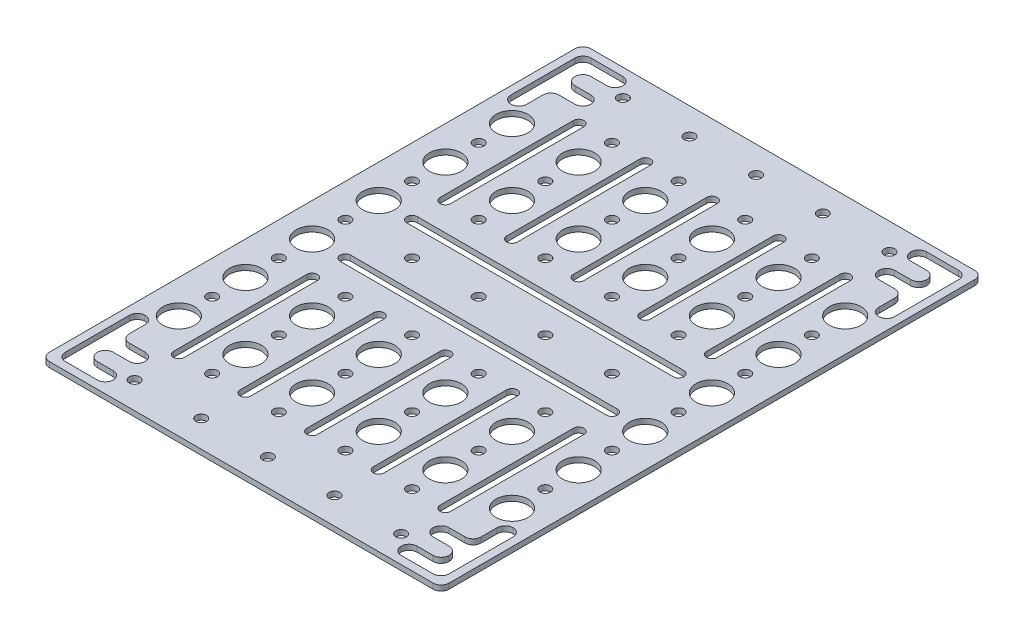
from build123d import *

# Parameters (mm, degrees)
SKETCH_1_W          = 150
SKETCH_1_H          = 203.2
EXTRUDE_1_DEPTH     = 2
SKETCH_2_R          = 2
SKETCH_2_R_2        = 6
CUT_EXTRUDE_1_DEPTH = 127.299485351
CUT_EXTRUDE_2_DEPTH = 127.299485351
FILLET_1_R          = 3


with BuildPart() as part:
    # 草图1 → 凸台-拉伸1 (new body)
    with BuildSketch(Plane(origin=(0, 0, 0), x_dir=(1, 0, 0), z_dir=(0, 1, 0))):
        Rectangle(SKETCH_1_W, SKETCH_1_H)
    extrude(amount=EXTRUDE_1_DEPTH)

    # 草图2 → 切除-拉伸1 (cut, through all)
    with BuildSketch(Plane(origin=(0, 2, 0), x_dir=(1, 0, 0), z_dir=(0, 1, 0))):
        with Locations(Location((-50, 91.6, 0), (0, 0, 270))):
            Circle(SKETCH_2_R)
        with Locations(Location((-25, 91.6, 0), (0, 0, 270))):
            Circle(SKETCH_2_R)
        with Locations(Location((0, 91.6, 0), (0, 0, 270))):
            Circle(SKETCH_2_R)
        with Locations(Location((25, 91.6, 0), (0, 0, 270))):
            Circle(SKETCH_2_R)
        with Locations(Location((50, 91.6, 0), (0, 0, 270))):
            Circle(SKETCH_2_R)
        with Locations(Location((50, -91.6, 0), (0, 0, 90))):
            Circle(SKETCH_2_R)
        with Locations(Location((25, -91.6, 0), (0, 0, 90))):
            Circle(SKETCH_2_R)
        with Locations(Location((0, -91.6, 0), (0, 0, 90))):
            Circle(SKETCH_2_R)
        with Locations(Location((-25, -91.6, 0), (0, 0, 90))):
            Circle(SKETCH_2_R)
        with Locations(Location((-50, -91.6, 0), (0, 0, 90))):
            Circle(SKETCH_2_R)
        with Locations(Location((-62.5, 0, 0), (0, 0, 270))):
            Circle(SKETCH_2_R)
        with Locations(Location((-37.5, 0, 0), (0, 0, 270))):
            Circle(SKETCH_2_R)
        with Locations(Location((-12.5, 0, 0), (0, 0, 270))):
            Circle(SKETCH_2_R)
        with Locations(Location((12.5, 0, 0), (0, 0, 270))):
            Circle(SKETCH_2_R)
        with Locations(Location((37.5, 0, 0), (0, 0, 270))):
            Circle(SKETCH_2_R)
        with Locations(Location((62.5, 0, 0), (0, 0, 270))):
            Circle(SKETCH_2_R)
        with Locations(Location((-37.5, 25, 0), (0, 0, 270))):
            Circle(SKETCH_2_R)
        with Locations(Location((-12.5, 25, 0), (0, 0, 270))):
            Circle(SKETCH_2_R)
        with Locations(Location((12.5, 25, 0), (0, 0, 270))):
            Circle(SKETCH_2_R)
        with Locations(Location((37.5, 25, 0), (0, 0, 270))):
            Circle(SKETCH_2_R)
        with Locations(Location((62.5, 25, 0), (0, 0, 270))):
            Circle(SKETCH_2_R)
        with Locations(Location((-37.5, 50, 0), (0, 0, 270))):
            Circle(SKETCH_2_R)
        with Locations(Location((-12.5, 50, 0), (0, 0, 270))):
            Circle(SKETCH_2_R)
        with Locations(Location((12.5, 50, 0), (0, 0, 270))):
            Circle(SKETCH_2_R)
        with Locations(Location((37.5, 50, 0), (0, 0, 270))):
            Circle(SKETCH_2_R)
        with Locations(Location((62.5, 50, 0), (0, 0, 270))):
            Circle(SKETCH_2_R)
        with Locations(Location((-37.5, 75, 0), (0, 0, 270))):
            Circle(SKETCH_2_R)
        with Locations(Location((-12.5, 75, 0), (0, 0, 270))):
            Circle(SKETCH_2_R)
        with Locations(Location((12.5, 75, 0), (0, 0, 270))):
            Circle(SKETCH_2_R)
        with Locations(Location((37.5, 75, 0), (0, 0, 270))):
            Circle(SKETCH_2_R)
        with Locations(Location((-62.5, 25, 0), (0, 0, 270))):
            Circle(SKETCH_2_R)
        with Locations(Location((-62.5, 50, 0), (0, 0, 270))):
            Circle(SKETCH_2_R)
        with Locations(Location((62.5, -25, 0), (0, 0, 90))):
            Circle(SKETCH_2_R)
        with Locations(Location((37.5, -25, 0), (0, 0, 90))):
            Circle(SKETCH_2_R)
        with Locations(Location((12.5, -25, 0), (0, 0, 90))):
            Circle(SKETCH_2_R)
        with Locations(Location((-12.5, -25, 0), (0, 0, 90))):
            Circle(SKETCH_2_R)
        with Locations(Location((-37.5, -25, 0), (0, 0, 90))):
            Circle(SKETCH_2_R)
        with Locations(Location((-62.5, -25, 0), (0, 0, 90))):
            Circle(SKETCH_2_R)
        with Locations(Location((-62.5, -50, 0), (0, 0, 90))):
            Circle(SKETCH_2_R)
        with Locations(Location((-37.5, -50, 0), (0, 0, 90))):
            Circle(SKETCH_2_R)
        with Locations(Location((-12.5, -50, 0), (0, 0, 90))):
            Circle(SKETCH_2_R)
        with Locations(Location((12.5, -50, 0), (0, 0, 90))):
            Circle(SKETCH_2_R)
        with Locations(Location((37.5, -50, 0), (0, 0, 90))):
            Circle(SKETCH_2_R)
        with Locations(Location((62.5, -50, 0), (0, 0, 90))):
            Circle(SKETCH_2_R)
        with Locations(Location((37.5, -75, 0), (0, 0, 90))):
            Circle(SKETCH_2_R)
        with Locations(Location((12.5, -75, 0), (0, 0, 90))):
            Circle(SKETCH_2_R)
        with Locations(Location((-12.5, -75, 0), (0, 0, 90))):
            Circle(SKETCH_2_R)
        with Locations(Location((-37.5, -75, 0), (0, 0, 90))):
            Circle(SKETCH_2_R)
        with Locations(Location((-62.5, 62.5, 0), (0, 0, 270))):
            Circle(SKETCH_2_R_2)
        with Locations(Location((-37.5, 62.5, 0), (0, 0, 270))):
            Circle(SKETCH_2_R_2)
        with Locations(Location((-12.5, 62.5, 0), (0, 0, 270))):
            Circle(SKETCH_2_R_2)
        with Locations(Location((12.5, 62.5, 0), (0, 0, 270))):
            Circle(SKETCH_2_R_2)
        with Locations(Location((37.5, 62.5, 0), (0, 0, 270))):
            Circle(SKETCH_2_R_2)
        with Locations(Location((62.5, 62.5, 0), (0, 0, 270))):
            Circle(SKETCH_2_R_2)
        with Locations(Location((-37.5, 37.5, 0), (0, 0, 270))):
            Circle(SKETCH_2_R_2)
        with Locations(Location((-12.5, 37.5, 0), (0, 0, 270))):
            Circle(SKETCH_2_R_2)
        with Locations(Location((12.5, 37.5, 0), (0, 0, 270))):
            Circle(SKETCH_2_R_2)
        with Locations(Location((37.5, 37.5, 0), (0, 0, 270))):
            Circle(SKETCH_2_R_2)
        with Locations(Location((62.5, 37.5, 0), (0, 0, 270))):
            Circle(SKETCH_2_R_2)
        with Locations(Location((62.5, 12.5, 0), (0, 0, 270))):
            Circle(SKETCH_2_R_2)
        with Locations(Location((62.5, -12.5, 0), (0, 0, 270))):
            Circle(SKETCH_2_R_2)
        with Locations(Location((-37.5, -37.5, 0), (0, 0, 270))):
            Circle(SKETCH_2_R_2)
        with Locations(Location((-12.5, -37.5, 0), (0, 0, 270))):
            Circle(SKETCH_2_R_2)
        with Locations(Location((12.5, -37.5, 0), (0, 0, 270))):
            Circle(SKETCH_2_R_2)
        with Locations(Location((37.5, -37.5, 0), (0, 0, 270))):
            Circle(SKETCH_2_R_2)
        with Locations(Location((62.5, -37.5, 0), (0, 0, 270))):
            Circle(SKETCH_2_R_2)
        with Locations(Location((-37.5, -62.5, 0), (0, 0, 270))):
            Circle(SKETCH_2_R_2)
        with Locations(Location((-12.5, -62.5, 0), (0, 0, 270))):
            Circle(SKETCH_2_R_2)
        with Locations(Location((12.5, -62.5, 0), (0, 0, 270))):
            Circle(SKETCH_2_R_2)
        with Locations(Location((37.5, -62.5, 0), (0, 0, 270))):
            Circle(SKETCH_2_R_2)
        with Locations(Location((62.5, -62.5, 0), (0, 0, 270))):
            Circle(SKETCH_2_R_2)
        with Locations(Location((-62.5, 37.5, 0), (0, 0, 270))):
            Circle(SKETCH_2_R_2)
        with Locations(Location((-62.5, 12.5, 0), (0, 0, 270))):
            Circle(SKETCH_2_R_2)
        with Locations(Location((-62.5, -12.5, 0), (0, 0, 270))):
            Circle(SKETCH_2_R_2)
        with Locations(Location((-62.5, -37.5, 0), (0, 0, 270))):
            Circle(SKETCH_2_R_2)
        with Locations(Location((-62.5, -62.5, 0), (0, 0, 270))):
            Circle(SKETCH_2_R_2)
        with BuildLine():
            Line((-48, 75), (-48, 25))
            ThreePointArc((-48, 25), (-50, 23), (-52, 25))
            Line((-52, 25), (-52, 75))
            ThreePointArc((-52, 75), (-50, 77), (-48, 75))
        make_face()
        with BuildLine():
            Line((-23, 75), (-23, 25))
            ThreePointArc((-23, 25), (-25, 23), (-27, 25))
            Line((-27, 25), (-27, 75))
            ThreePointArc((-27, 75), (-25, 77), (-23, 75))
        make_face()
        with BuildLine():
            Line((2, 75), (2, 25))
            ThreePointArc((2, 25), (0, 23), (-2, 25))
            Line((-2, 25), (-2, 75))
            ThreePointArc((-2, 75), (0, 77), (2, 75))
        make_face()
        with BuildLine():
            Line((27, 75), (27, 25))
            ThreePointArc((27, 25), (25, 23), (23, 25))
            Line((23, 25), (23, 75))
            ThreePointArc((23, 75), (25, 77), (27, 75))
        make_face()
        with BuildLine():
            Line((52, 75), (52, 25))
            ThreePointArc((52, 25), (50, 23), (48, 25))
            Line((48, 25), (48, 75))
            ThreePointArc((48, 75), (50, 77), (52, 75))
        make_face()
        with BuildLine():
            Line((-48, -75), (-48, -25))
            ThreePointArc((-48, -25), (-50, -23), (-52, -25))
            Line((-52, -25), (-52, -75))
            ThreePointArc((-52, -75), (-50, -77), (-48, -75))
        make_face()
        with BuildLine():
            Line((-23, -75), (-23, -25))
            ThreePointArc((-23, -25), (-25, -23), (-27, -25))
            Line((-27, -25), (-27, -75))
            ThreePointArc((-27, -75), (-25, -77), (-23, -75))
        make_face()
        with BuildLine():
            Line((2, -75), (2, -25))
            ThreePointArc((2, -25), (0, -23), (-2, -25))
            Line((-2, -25), (-2, -75))
            ThreePointArc((-2, -75), (0, -77), (2, -75))
        make_face()
        with BuildLine():
            Line((27, -75), (27, -25))
            ThreePointArc((27, -25), (25, -23), (23, -25))
            Line((23, -25), (23, -75))
            ThreePointArc((23, -75), (25, -77), (27, -75))
        make_face()
        with BuildLine():
            Line((52, -75), (52, -25))
            ThreePointArc((52, -25), (50, -23), (48, -25))
            Line((48, -25), (48, -75))
            ThreePointArc((48, -75), (50, -77), (52, -75))
        make_face()
        with BuildLine():
            Line((-50, 14.5), (50, 14.5))
            ThreePointArc((50, 14.5), (52, 12.5), (50, 10.5))
            Line((50, 10.5), (-50, 10.5))
            ThreePointArc((-50, 10.5), (-52, 12.5), (-50, 14.5))
        make_face()
        with BuildLine():
            Line((-50, -14.5), (50, -14.5))
            ThreePointArc((50, -14.5), (52, -12.5), (50, -10.5))
            Line((50, -10.5), (-50, -10.5))
            ThreePointArc((-50, -10.5), (-52, -12.5), (-50, -14.5))
        make_face()
    extrude(amount=-CUT_EXTRUDE_1_DEPTH, mode=Mode.SUBTRACT)

    # 草图3 → 切除-拉伸2 (cut, through all)
    with BuildSketch(Plane(origin=(0, 2, 0), x_dir=(1, 0, 0), z_dir=(0, 1, 0))):
        Polygon((-72, 98.6), (-54, 98.6), (-54, 92.6), (-66, 92.6), (-66, 86.6), (-54, 86.6), (-54, 80.6), (-66, 80.6), (-66, 68.6), (-72, 68.6), align=None)
        Polygon((66, 68.6), (72, 68.6), (72, 98.6), (54, 98.6), (54, 92.6), (66, 92.6), (66, 86.6), (54, 86.6), (54, 80.6), (66, 80.6), align=None)
        Polygon((-66, -68.6), (-72, -68.6), (-72, -98.6), (-54, -98.6), (-54, -92.6), (-66, -92.6), (-66, -86.6), (-54, -86.6), (-54, -80.6), (-66, -80.6), align=None)
        Polygon((66, -80.6), (66, -68.6), (72, -68.6), (72, -98.6), (54, -98.6), (54, -92.6), (66, -92.6), (66, -86.6), (54, -86.6), (54, -80.6), align=None)
    extrude(amount=-CUT_EXTRUDE_2_DEPTH, mode=Mode.SUBTRACT)

    # 圆角1
    fillet_1_edges = [part.edges().sort_by_distance(p)[0] for p in [
        (72, 1, 68.6),
        (72, 1, 98.6),
        (54, 1, 98.6),
        (54, 1, 86.6),
        (66, 1, 86.6),
        (54, 1, 80.6),
        (66, 1, 80.6),
        (66, 1, 68.6),
        (54, 1, 92.6),
        (66, 1, 92.6),
        (75, 1, 101.6),
        (-72, 1, 68.6),
        (-66, 1, 68.6),
        (-54, 1, 80.6),
        (-75, 1, 101.6),
        (-72, 1, 98.6),
        (-66, 1, 80.6),
        (-54, 1, 86.6),
        (-66, 1, 86.6),
        (-66, 1, 92.6),
        (-54, 1, 98.6),
        (72, 1, -68.6),
        (66, 1, -68.6),
        (72, 1, -98.6),
        (54, 1, -86.6),
        (54, 1, -98.6),
        (66, 1, -80.6),
        (54, 1, -80.6),
        (66, 1, -86.6),
        (66, 1, -92.6),
        (54, 1, -92.6),
        (75, 1, -101.6),
        (-72, 1, -68.6),
        (-66, 1, -68.6),
        (-54, 1, -80.6),
        (-66, 1, -80.6),
        (-75, 1, -101.6),
        (-54, 1, -98.6),
        (-54, 1, -86.6),
        (-66, 1, -86.6),
        (-66, 1, -92.6),
        (-72, 1, -98.6),
        (-54, 1, -92.6),
        (-54, 1, 92.6),
    ]]
    fillet(fillet_1_edges, radius=FILLET_1_R - 0.0001)  # a hair under: the kernel refuses the full size


solid = part.part
